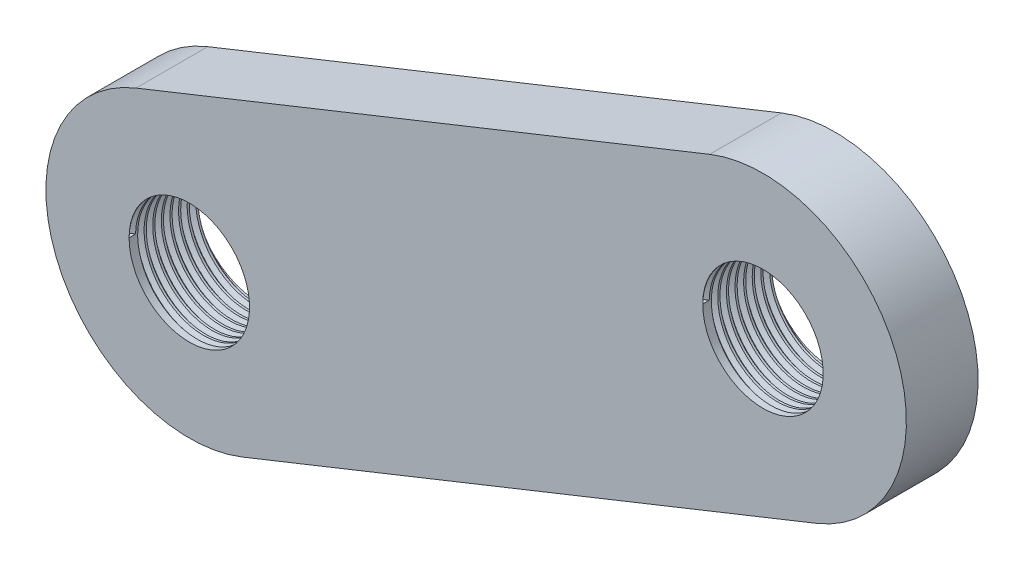
from build123d import *

# Parameters (mm, degrees)
SK_BIELA_INTERIOR_R  = 2.1
BIELA_INTERIOR_DEPTH = 2.5
ROSCA1_PITCH         = 0.3
ROSCA2_PITCH         = 0.3


with BuildPart() as part:
    # Sk_Biela_interior → Biela_interior (new body)
    with BuildSketch(Plane.XY.offset(51.9)):
        with BuildLine():
            Line((-42.143046618, -54.642383454), (-22.143046618, -46.642383454))
            ThreePointArc((-22.143046618, -46.642383454), (-19.357616546, -40.143046618), (-25.856953382, -37.357616546))
            Line((-25.856953382, -37.357616546), (-45.856953382, -45.357616546))
            ThreePointArc((-45.856953382, -45.357616546), (-48.642383454, -51.856953382), (-42.143046618, -54.642383454))
        make_face()
        with Locations((-24, -42)):
            Circle(SK_BIELA_INTERIOR_R, mode=Mode.SUBTRACT)
        with Locations((-44, -50)):
            Circle(SK_BIELA_INTERIOR_R, mode=Mode.SUBTRACT)
    extrude(amount=BIELA_INTERIOR_DEPTH)

    # Rosca1: the profile of Perfil de rosca1 profile screwed along a right-hand helix of 9 turns, 6 arcs to a turn; built about Z, then put on its axis
    rosca1_z = Axis((0, 0, 0), (0, 0, 1))
    rosca1_corners = [(2.0997, 0, -0.000173205), (2.262379762, 0, 0.09375), (2.262379762, 0, 0.13125), (2.0997, 0, 0.225173204)]
    with BuildLine(mode=Mode.PRIVATE) as rosca1_profile:
        Line(rosca1_corners[0], rosca1_corners[1])
        Line(rosca1_corners[1], rosca1_corners[2])
        Line(rosca1_corners[2], rosca1_corners[3])
        Line(rosca1_corners[3], rosca1_corners[0])
    rosca1_cap = Face(rosca1_profile.wire())
    rosca1_turn_angles = [0, 30, 60, 90, 120, 150, 180, 210, 240, 270, 300, 330, 360]
    rosca1_turn_weights = [1, 0.8660254037844387, 1, 0.8660254037844387, 1, 0.8660254037844387, 1, 0.8660254037844387, 1, 0.8660254037844387, 1, 0.8660254037844387, 1]
    rosca1_turn_rails = [Edge.make_bspline([Vector(p[0], p[1], 0).rotate(rosca1_z, rosca1_turn_angles[k]) / rosca1_turn_weights[k] + Vector(0, 0, p[2] + ROSCA1_PITCH * rosca1_turn_angles[k] / 360) for k in range(13)], [0, 0, 0, 1, 1, 2, 2, 3, 3, 4, 4, 5, 5, 6, 6, 6], 2, rosca1_turn_weights) for p in rosca1_corners]
    rosca1_turn_sides = [Face.make_surface_from_curves(rosca1_turn_rails[p[0]], rosca1_turn_rails[p[1]]) for p in [(0, 1), (1, 2), (2, 3), (3, 0)]]
    rosca1 = Plane(origin=(-24, -42, 54.4), x_dir=(-1, 0, 0), z_dir=(0, 0, -1)) * Solid(Shell([*[p.moved(Location((0, 0, ROSCA1_PITCH * i))) for i in range(9) for p in rosca1_turn_sides], rosca1_cap, rosca1_cap.rotate(rosca1_z, 3240).moved(Location((0, 0, ROSCA1_PITCH * 3240 / 360)))]))
    add(rosca1, mode=Mode.SUBTRACT)

    # Rosca2: the profile of Perfil de rosca2 profile screwed along a right-hand helix of 9 turns, 6 arcs to a turn; built about Z, then put on its axis
    rosca2_z = Axis((0, 0, 0), (0, 0, 1))
    rosca2_corners = [(2.0997, 0, -0.000173205), (2.262379762, 0, 0.09375), (2.262379762, 0, 0.13125), (2.0997, 0, 0.225173204)]
    with BuildLine(mode=Mode.PRIVATE) as rosca2_profile:
        Line(rosca2_corners[0], rosca2_corners[1])
        Line(rosca2_corners[1], rosca2_corners[2])
        Line(rosca2_corners[2], rosca2_corners[3])
        Line(rosca2_corners[3], rosca2_corners[0])
    rosca2_cap = Face(rosca2_profile.wire())
    rosca2_turn_angles = [0, 30, 60, 90, 120, 150, 180, 210, 240, 270, 300, 330, 360]
    rosca2_turn_weights = [1, 0.8660254037844387, 1, 0.8660254037844387, 1, 0.8660254037844387, 1, 0.8660254037844387, 1, 0.8660254037844387, 1, 0.8660254037844387, 1]
    rosca2_turn_rails = [Edge.make_bspline([Vector(p[0], p[1], 0).rotate(rosca2_z, rosca2_turn_angles[k]) / rosca2_turn_weights[k] + Vector(0, 0, p[2] + ROSCA2_PITCH * rosca2_turn_angles[k] / 360) for k in range(13)], [0, 0, 0, 1, 1, 2, 2, 3, 3, 4, 4, 5, 5, 6, 6, 6], 2, rosca2_turn_weights) for p in rosca2_corners]
    rosca2_turn_sides = [Face.make_surface_from_curves(rosca2_turn_rails[p[0]], rosca2_turn_rails[p[1]]) for p in [(0, 1), (1, 2), (2, 3), (3, 0)]]
    rosca2 = Plane(origin=(-44, -50, 54.4), x_dir=(-1, 0, 0), z_dir=(0, 0, -1)) * Solid(Shell([*[p.moved(Location((0, 0, ROSCA2_PITCH * i))) for i in range(9) for p in rosca2_turn_sides], rosca2_cap, rosca2_cap.rotate(rosca2_z, 3240).moved(Location((0, 0, ROSCA2_PITCH * 3240 / 360)))]))
    add(rosca2, mode=Mode.SUBTRACT)


solid = part.part
